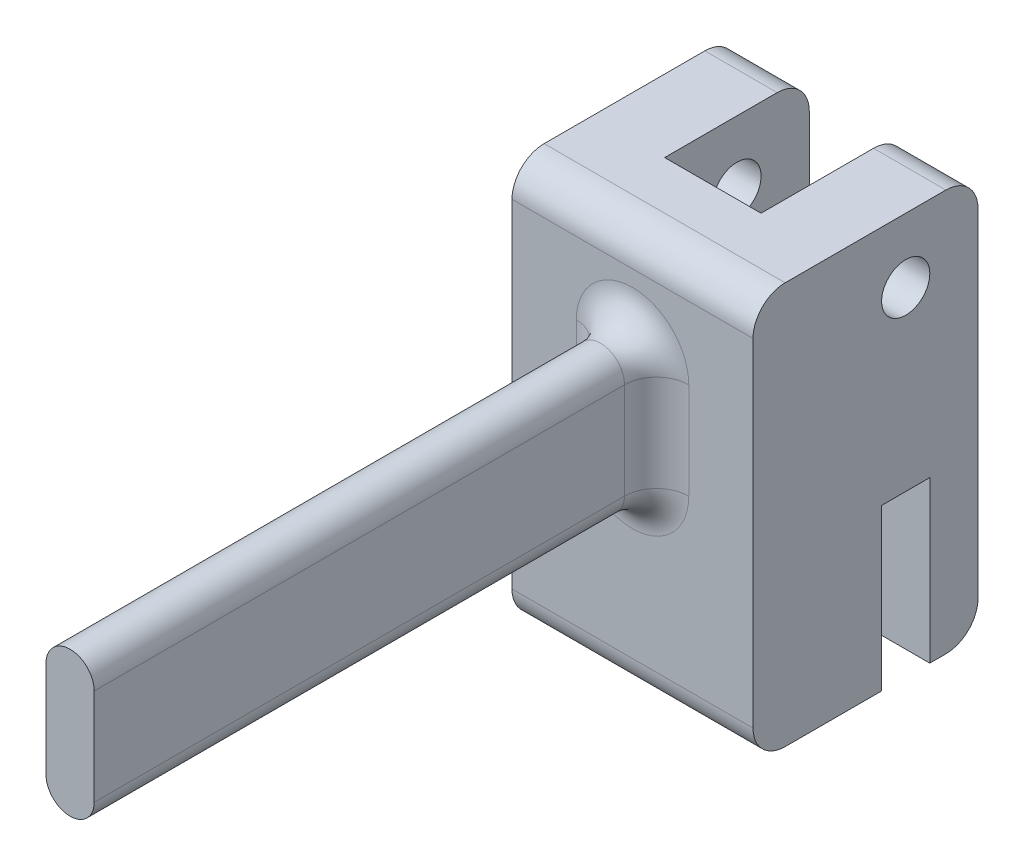
from build123d import *

# Parameters (mm, degrees)
CROQUIS2_W                 = 15
CROQUIS2_H                 = 15
SALIENTE_EXTRUIR1_DEPTH    = 4.5
CROQUIS3_W                 = 15
CROQUIS3_H                 = 10
CORTAR_EXTRUIR1_DEPTH      = 1.5
CORTAR_EXTRUIR2_DEPTH      = 12.521718622
CROQUIS10_W                = 4.5
CROQUIS10_H                = 9
SALIENTE_EXTRUIR4_DEPTH    = 10
CORTAR_EXTRUIR3_DEPTH      = 20.563997547
CORTAR_EXTRUIR3_DEPTH_BACK = 20.563997547
CROQUIS7_R                 = 1.5
CROQUIS12_W                = 15
CROQUIS12_H                = 25
SALIENTE_EXTRUIR5_DEPTH    = 5
REDONDEO2_R                = 2
SALIENTE_EXTRUIR6_DEPTH    = 35
REDONDEO4_R                = 2


with BuildPart() as part:
    # Croquis2 → Saliente-Extruir1 (new, symmetric)
    with BuildSketch(Plane.XY):
        Rectangle(CROQUIS2_W, CROQUIS2_H)
    extrude(amount=SALIENTE_EXTRUIR1_DEPTH, both=True)

    # Croquis3 → Cortar-Extruir1 (cut, symmetric)
    with BuildSketch(Plane.XY):
        with Locations((0, -2.5)):
            Rectangle(CROQUIS3_W, CROQUIS3_H)
    extrude(amount=CORTAR_EXTRUIR1_DEPTH, both=True, mode=Mode.SUBTRACT)

    # Croquis4 → Cortar-Extruir2 (cut, through all)
    with BuildSketch(Plane.XY):
        with BuildLine():
            Line((-1.5, 0), (-1.5, -7.5))
            Line((-1.5, -7.5), (1.5, -7.5))
            Line((1.5, -7.5), (1.5, 0))
            ThreePointArc((1.5, 0), (0, 1.5), (-1.5, 0))
        make_face()
    extrude(amount=-CORTAR_EXTRUIR2_DEPTH, mode=Mode.SUBTRACT)

    # Croquis10 → Saliente-Extruir4 (add)
    with BuildSketch(Plane(origin=(0, 7.5, 0), x_dir=(1, 0, 0), z_dir=(0, 1, 0))):
        with Locations((-5.25, 0)):
            Rectangle(CROQUIS10_W, CROQUIS10_H)
        with Locations((5.25, 0)):
            Rectangle(CROQUIS10_W, CROQUIS10_H)
    extrude(amount=SALIENTE_EXTRUIR4_DEPTH)

    # Croquis7 → Cortar-Extruir3 (cut, two sides: drawn at the far end of the back side and taken through both)
    with BuildSketch(Plane(origin=(0, 0, 0), x_dir=(0, 0, -1), z_dir=(1, 0, 0)).offset(-CORTAR_EXTRUIR3_DEPTH_BACK)):
        with Locations((0, 13.5)):
            Circle(CROQUIS7_R)
    extrude(amount=CORTAR_EXTRUIR3_DEPTH + CORTAR_EXTRUIR3_DEPTH_BACK, mode=Mode.SUBTRACT)

    # Croquis12 → Saliente-Extruir5 (add)
    with BuildSketch(Plane.XY.offset(4.5)):
        with Locations((0, 5)):
            Rectangle(CROQUIS12_W, CROQUIS12_H)
    extrude(amount=SALIENTE_EXTRUIR5_DEPTH)

    # Redondeo2
    redondeo2_edges = [part.edges().sort_by_distance(p)[0] for p in [
        (5.25, 17.5, -4.5),
        (-5.25, 17.5, -4.5),
        (0, 17.5, 9.5),
        (-4.5, -7.5, -4.5),
        (4.5, -7.5, -4.5),
        (0, -7.5, 9.5),
    ]]
    fillet(redondeo2_edges, radius=REDONDEO2_R)

    # Croquis11 → Saliente-Extruir6 (add)
    with BuildSketch(Plane.XY.offset(9.5)):
        with BuildLine():
            Line((1.5, 11), (1.5, 5))
            ThreePointArc((1.5, 5), (0, 3.5), (-1.5, 5))
            Line((-1.5, 5), (-1.5, 11))
            ThreePointArc((-1.5, 11), (0, 12.5), (1.5, 11))
        make_face()
    extrude(amount=SALIENTE_EXTRUIR6_DEPTH)

    # Redondeo4
    redondeo4_edges = [part.edges().sort_by_distance(p)[0] for p in [
        (0, 12.5, 9.5),
        (1.5, 8, 9.5),
        (0, 3.5, 9.5),
        (-1.5, 8, 9.5),
    ]]
    fillet(redondeo4_edges, radius=REDONDEO4_R)


solid = part.part
